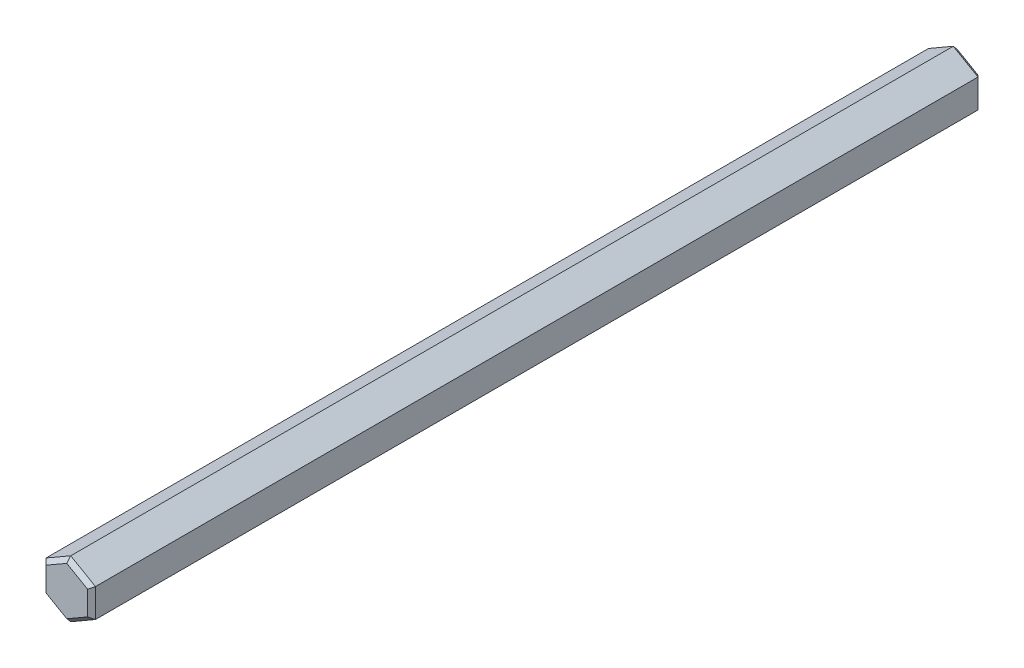
from build123d import *

# Parameters (mm, degrees)
BOSS_EXTRUDE1_DEPTH = 90
CHAMFER1_SIZE       = 0.4


with BuildPart() as part:
    # Sketch1 → Boss-Extrude1 (new body)
    with BuildSketch(Plane.XY.offset(75)):
        Polygon((0, -2.886751346), (2.5, -1.443375673), (2.5, 1.443375673), (0, 2.886751346), (-2.5, 1.443375673), (-2.5, -1.443375673), align=None)
    extrude(amount=-BOSS_EXTRUDE1_DEPTH)

    # Chamfer1
    chamfer1_edges = [part.edges().sort_by_distance(p)[0] for p in [
        (-2.5, 0, -15),
        (-1.25, -2.165063509, -15),
        (-1.25, 2.165063509, -15),
        (1.25, -2.165063509, -15),
        (1.25, 2.165063509, -15),
        (2.5, 0, -15),
        (-1.25, 2.165063509, 75),
        (-2.5, 0, 75),
        (1.25, 2.165063509, 75),
        (-1.25, -2.165063509, 75),
        (2.5, 0, 75),
        (1.25, -2.165063509, 75),
    ]]
    chamfer(chamfer1_edges, length=CHAMFER1_SIZE)


solid = part.part
